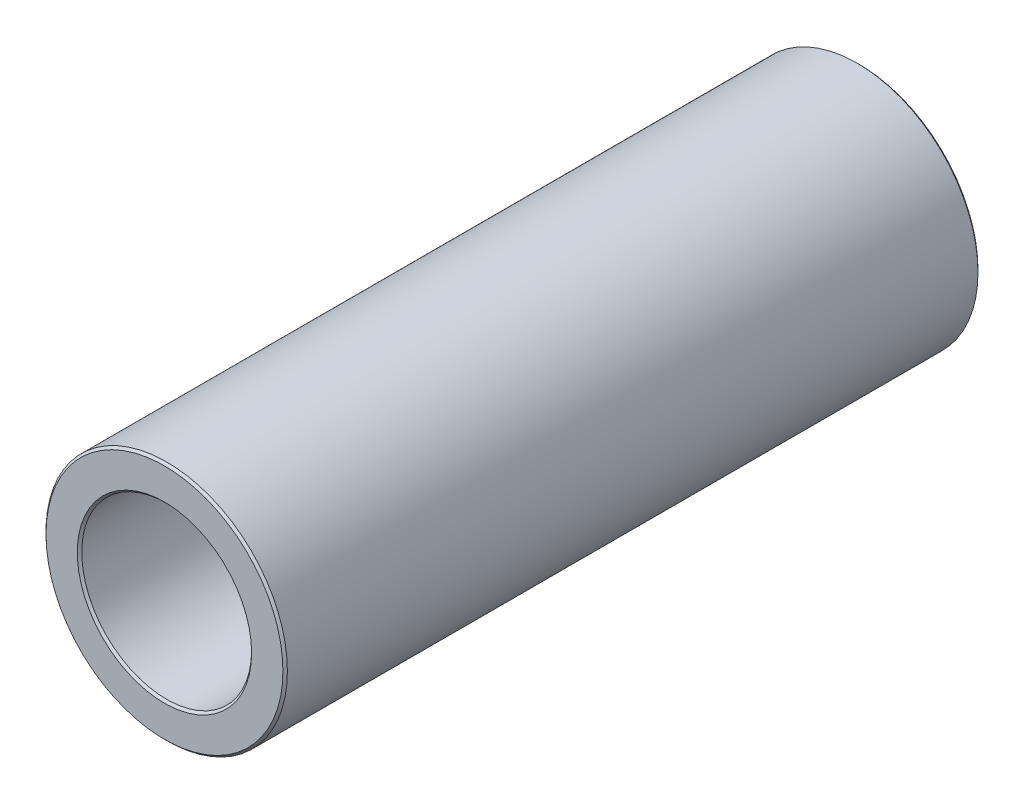
from build123d import *

# Parameters (mm, degrees)
AUFSATZ_LINEAR_AUSTRAGEN1_DEPTH      = 79
AUFSATZ_LINEAR_AUSTRAGEN1_DEPTH_BACK = 76.5
SKIZZE1_R                            = 27
SKIZZE1_R_2                          = 19
FASE1_SIZE                           = 0.5


with BuildPart() as part:
    # Skizze1 → Aufsatz-Linear austragen1 (new, two sides: drawn at the far end of the back side and taken through both)
    with BuildSketch(Plane.XY.offset(-AUFSATZ_LINEAR_AUSTRAGEN1_DEPTH_BACK)):
        Circle(SKIZZE1_R)
        Circle(SKIZZE1_R_2, mode=Mode.SUBTRACT)
    extrude(amount=AUFSATZ_LINEAR_AUSTRAGEN1_DEPTH + AUFSATZ_LINEAR_AUSTRAGEN1_DEPTH_BACK)

    # Fase1
    fase1_edges = [part.edges().sort_by_distance(p)[0] for p in [
        (-27, 0, -76.5),
        (-27, 0, 79),
        (-19, 0, -76.5),
        (-19, 0, 79),
    ]]
    chamfer(fase1_edges, length=FASE1_SIZE)


solid = part.part
